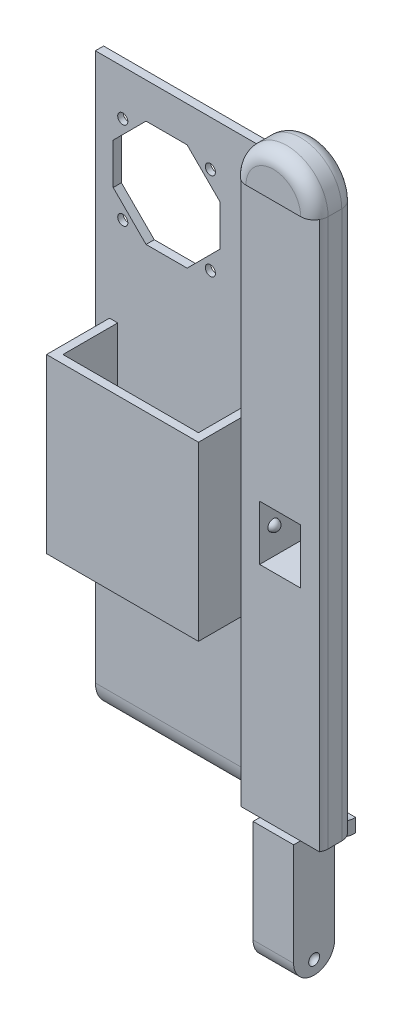
from build123d import *

# Parameters (mm, degrees)
BOSS_EXTRUDE1_DEPTH = 7.5
FILLET1_R           = 5
SKETCH2_W           = 15
SKETCH2_H           = 20
CUT_EXTRUDE1_DEPTH  = 152.492574075
FILLET6_R           = 5
CUT_EXTRUDE2_DEPTH  = 152.848641746
BOSS_EXTRUDE2_DEPTH = 80
BOSS_EXTRUDE3_START = 5
BOSS_EXTRUDE3_DEPTH = 5
SKETCH12_W          = 12.5
SKETCH12_H          = 20
CUT_EXTRUDE3_DEPTH  = 3
SKETCH13_W          = 2.5
SKETCH13_H          = 200
CUT_EXTRUDE4_DEPTH  = 160.863222787
SKETCH14_R          = 1.85
CUT_EXTRUDE5_DEPTH  = 10
SKETCH15_R          = 3.25
CUT_EXTRUDE6_DEPTH  = 1
BOSS_EXTRUDE4_DEPTH = 170
SKETCH17_W          = 23
SKETCH17_H          = 82.019259302
SKETCH17_H_2        = 27.980740698
CUT_EXTRUDE7_DEPTH  = 56
SKETCH18_W          = 23
SKETCH18_H          = 3
BOSS_EXTRUDE5_DEPTH = 55.5


with BuildPart() as part:
    # Sketch1 → Boss-Extrude1 (new, symmetric)
    with BuildSketch(Plane.XY):
        with BuildLine():
            Line((-15, 100), (-15, -100))
            Line((-15, -100), (-7.4, -100))
            Line((-7.4, -100), (-7.4, -150))
            Line((-7.4, -150), (7.4, -150))
            Line((7.4, -150), (7.4, -100))
            Line((7.4, -100), (15, -100))
            Line((15, -100), (15, 100))
            ThreePointArc((15, 100), (0, 115), (-15, 100))
        make_face()
    extrude(amount=BOSS_EXTRUDE1_DEPTH, both=True)

    # Fillet1
    fillet1_edges = [part.edges().sort_by_distance(p)[0] for p in [
        (-15, 0, -7.5),
        (0, 115, -7.5),
        (-15, 0, 7.5),
        (0, 115, 7.5),
        (15, 0, -7.5),
        (15, 0, 7.5),
    ]]
    fillet(fillet1_edges, radius=FILLET1_R)

    # Sketch2 → Cut-Extrude1 (cut, through all)
    with BuildSketch(Plane.XY.offset(7.5)):
        with Locations((0, -10)):
            Rectangle(SKETCH2_W, SKETCH2_H)
    extrude(amount=-CUT_EXTRUDE1_DEPTH, mode=Mode.SUBTRACT)

    # Sketch5 → Cut-Revolve1 (revolve, cut)
    with BuildSketch(Plane.XY):
        with BuildLine():
            Line((-7.4, -140), (-5.4, -140))
            ThreePointArc((-5.4, -140), (-5.985786438, -138.585786438), (-7.4, -138))
            Line((-7.4, -138), (-7.4, -140))
        make_face()
        with BuildLine():
            Line((7.4, -140), (5.4, -140))
            ThreePointArc((5.4, -140), (5.985786438, -138.585786438), (7.4, -138))
            Line((7.4, -138), (7.4, -140))
        make_face()
    revolve(axis=Axis((-35.580304025, -140, 0), (1, 0, 0)), mode=Mode.SUBTRACT)

    # Fillet6
    fillet6_edges = [part.edges().sort_by_distance(p)[0] for p in [
        (-7.4, -150, 0),
        (7.4, -150, 0),
    ]]
    fillet(fillet6_edges, radius=FILLET6_R)

    # Sketch7 → Cut-Extrude2 (cut, through all)
    with BuildSketch(Plane(origin=(7.4, 0, 0), x_dir=(0, 0, -1), z_dir=(1, 0, 0))):
        with BuildLine():
            Line((-7.5, -137.5), (-7.5, -150))
            Line((-7.5, -150), (7.5, -150))
            Line((7.5, -150), (7.5, -137.5))
            ThreePointArc((7.5, -137.5), (0, -145), (-7.5, -137.5))
        make_face()
    extrude(amount=-CUT_EXTRUDE2_DEPTH, mode=Mode.SUBTRACT)

    # Sketch9 → Revolve2 (revolve)
    with BuildSketch(Plane.XY):
        with BuildLine():
            Line((-7.5, -10), (-5.5, -10))
            ThreePointArc((-5.5, -10), (-6.085786438, -8.585786438), (-7.5, -8))
            Line((-7.5, -8), (-7.5, -10))
        make_face()
        with BuildLine():
            Line((7.5, -10), (5.5, -10))
            ThreePointArc((5.5, -10), (6.085786438, -8.585786438), (7.5, -8))
            Line((7.5, -8), (7.5, -10))
        make_face()
    revolve(axis=Axis((-32.251262552, -10, 0), (1, 0, 0)))

    # Sketch10 → Boss-Extrude2 (add)
    with BuildSketch(Plane(origin=(0, 0, 0), x_dir=(0, 0, -1), z_dir=(1, 0, 0))):
        with BuildLine():
            Line((7.5, -100), (7.5, 100))
            Line((7.5, 100), (10.5, 100))
            Line((10.5, 100), (10.5, -98.519259302))
            ThreePointArc((10.5, -98.519259302), (12.584119567, -103.288955309), (17.5, -105))
            Line((17.5, -105), (17.5, -110))
            ThreePointArc((17.5, -110), (10.428932188, -107.071067812), (7.5, -100))
        make_face()
    extrude(amount=-BOSS_EXTRUDE2_DEPTH)

    # Sketch11 → Boss-Extrude3 (add)
    with BuildSketch(Plane(origin=(0, 0, 0), x_dir=(0, 0, -1), z_dir=(1, 0, 0)).offset(BOSS_EXTRUDE3_START)):
        with BuildLine():
            Line((17.5, -110), (17.5, -105))
            ThreePointArc((17.5, -105), (12.584119567, -103.288955309), (10.5, -98.519259302))
            Line((10.5, -98.519259302), (10.5, 100))
            Line((10.5, 100), (7.5, 100))
            Line((7.5, 100), (7.5, -100))
            ThreePointArc((7.5, -100), (10.428932188, -107.071067812), (17.5, -110))
        make_face()
    extrude(amount=-BOSS_EXTRUDE3_DEPTH)

    # Sketch12 → Cut-Extrude3 (cut)
    with BuildSketch(Plane(origin=(0, 0, -10.5), x_dir=(-1, 0, 0), z_dir=(0, 0, -1))):
        with Locations((1.25, -10)):
            Rectangle(SKETCH12_W, SKETCH12_H)
    extrude(amount=-CUT_EXTRUDE3_DEPTH, mode=Mode.SUBTRACT)

    # Sketch13 → Cut-Extrude4 (cut, through all)
    with BuildSketch(Plane.ZY.offset(15)):
        with Locations((6.25, 0)):
            Rectangle(SKETCH13_W, SKETCH13_H)
    extrude(amount=-CUT_EXTRUDE4_DEPTH, mode=Mode.SUBTRACT)

    # Sketch14 → Cut-Extrude5 (cut)
    with BuildSketch(Plane(origin=(0, 0, -10.5), x_dir=(-1, 0, 0), z_dir=(0, 0, -1))):
        with Locations((70, 51.480740698)):
            Circle(SKETCH14_R)
        with Locations((70, 83.480740698)):
            Circle(SKETCH14_R)
        with Locations((38, 83.480740698)):
            Circle(SKETCH14_R)
        with Locations((38, 51.480740698)):
            Circle(SKETCH14_R)
        Polygon((61.5, 86.980740698), (46.5, 86.980740698), (34.5, 74.980740698), (34.5, 59.980740698), (46.5, 47.980740698), (61.5, 47.980740698), (73.5, 59.980740698), (73.5, 74.980740698), align=None)
    extrude(amount=-CUT_EXTRUDE5_DEPTH, mode=Mode.SUBTRACT)

    # Sketch15 → Cut-Extrude6 (cut)
    with BuildSketch(Plane(origin=(0, 0, -10.5), x_dir=(-1, 0, 0), z_dir=(0, 0, -1))):
        with Locations((70, 83.480740698)):
            Circle(SKETCH15_R)
        with Locations((38, 83.480740698)):
            Circle(SKETCH15_R)
        with Locations((38, 51.480740698)):
            Circle(SKETCH15_R)
        with Locations((70, 51.480740698)):
            Circle(SKETCH15_R)
    extrude(amount=-CUT_EXTRUDE6_DEPTH, mode=Mode.SUBTRACT)

    # Sketch16 → Boss-Extrude4 (add)
    with BuildSketch(Plane(origin=(0, 100, 0), x_dir=(1, 0, 0), z_dir=(0, 1, 0))):
        Polygon((-71.85, -12.5), (-71.85, 7.5), (-74.85, 7.5), (-74.85, -15.5), (-19.35, -15.5), (-19.35, 7.5), (-22.35, 7.5), (-22.35, -12.5), align=None)
    extrude(amount=-BOSS_EXTRUDE4_DEPTH)

    # Sketch17 → Cut-Extrude7 (cut)
    with BuildSketch(Plane.ZY.offset(74.85)):
        with Locations((4, 58.990370349)):
            Rectangle(SKETCH17_W, SKETCH17_H)
        with Locations((4, -56.009629651)):
            Rectangle(SKETCH17_W, SKETCH17_H_2)
    extrude(amount=-CUT_EXTRUDE7_DEPTH, mode=Mode.SUBTRACT)

    # Sketch18 → Boss-Extrude5 (add)
    with BuildSketch(Plane.ZY.offset(74.85)):
        with Locations((4, -43.519259302)):
            Rectangle(SKETCH18_W, SKETCH18_H)
    extrude(amount=-BOSS_EXTRUDE5_DEPTH)


solid = part.part
